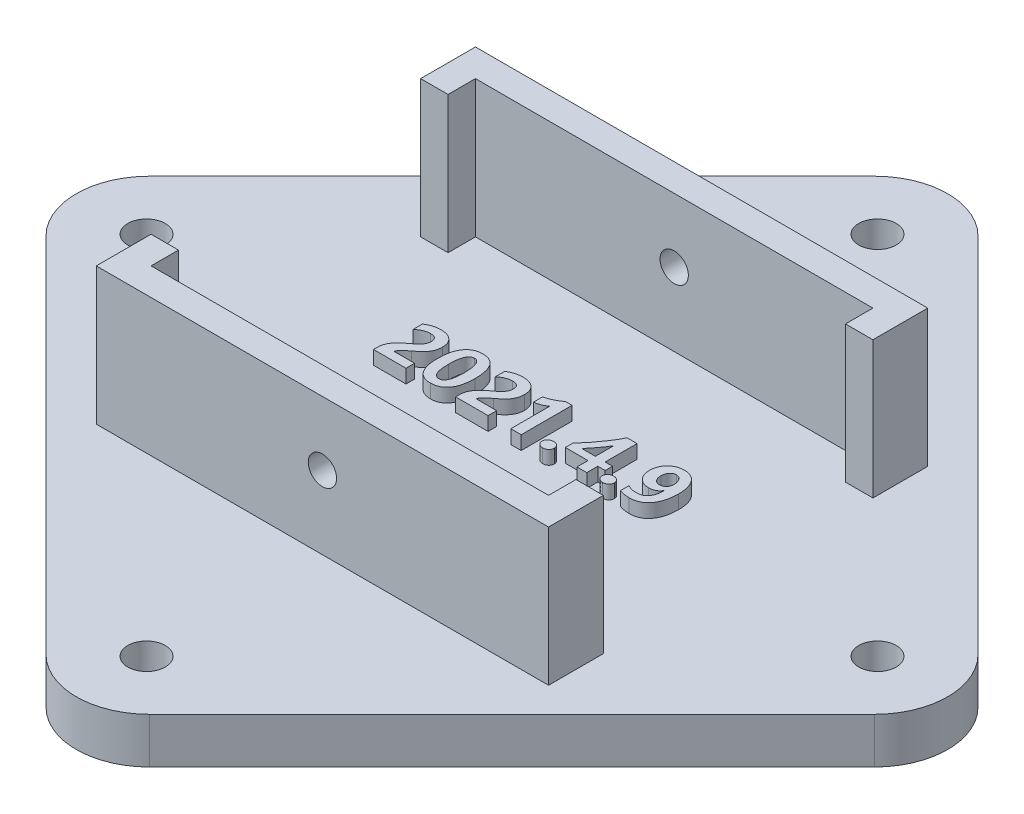
from build123d import *

# Parameters (mm, degrees)
SKETCH_1_R               = 2.05
EXTRUDE_1_DEPTH          = 5
EXTRUDE_2_DEPTH          = 15
CUT_EXTRUDE_1_DEPTH      = 86.775919648
CUT_EXTRUDE_1_DEPTH_BACK = 86.775919648
SKETCH_3_R               = 1.55
EXTRUDE_3_DEPTH          = 1.5


with BuildPart() as part:
    # 草图1 → 凸台-拉伸1 (new body)
    with BuildSketch(Plane(origin=(0, 0, 0), x_dir=(1, 0, 0), z_dir=(0, 1, 0))):
        with BuildLine():
            Line((-5.656854249, 45.343145751), (-45.343145751, 5.656854249))
            ThreePointArc((-45.343145751, 5.656854249), (-47.686291501, 0), (-45.343145751, -5.656854249))
            Line((-45.343145751, -5.656854249), (-5.656854249, -45.343145751))
            ThreePointArc((-5.656854249, -45.343145751), (0, -47.686291501), (5.656854249, -45.343145751))
            Line((5.656854249, -45.343145751), (45.343145751, -5.656854249))
            ThreePointArc((45.343145751, -5.656854249), (47.686291501, 0), (45.343145751, 5.656854249))
            Line((45.343145751, 5.656854249), (5.656854249, 45.343145751))
            ThreePointArc((5.656854249, 45.343145751), (0, 47.686291501), (-5.656854249, 45.343145751))
        make_face()
        with Locations((0, 40)):
            Circle(SKETCH_1_R, mode=Mode.SUBTRACT)
        with Locations((40, 0)):
            Circle(SKETCH_1_R, mode=Mode.SUBTRACT)
        with Locations((0, -40)):
            Circle(SKETCH_1_R, mode=Mode.SUBTRACT)
        with Locations((-40, 0)):
            Circle(SKETCH_1_R, mode=Mode.SUBTRACT)
    extrude(amount=EXTRUDE_1_DEPTH)

    # 草图2 → 凸台-拉伸2 (add)
    with BuildSketch(Plane(origin=(0, 5, 0), x_dir=(1, 0, 0), z_dir=(0, 1, 0))):
        Polygon((-24.75, 14.75), (-21.75, 14.75), (-21.75, 17.75), (21.75, 17.75), (21.75, 14.75), (24.75, 14.75), (24.75, 20.75), (-24.75, 20.75), align=None)
        Polygon((24.75, -20.75), (-24.75, -20.75), (-24.75, -14.75), (-21.75, -14.75), (-21.75, -17.75), (21.75, -17.75), (21.75, -14.75), (24.75, -14.75), align=None)
    extrude(amount=EXTRUDE_2_DEPTH)

    # 草图3 → 切除-拉伸1 (cut, two sides: drawn at the far end of the back side and taken through both)
    with BuildSketch(Plane.XY.offset(20.75).offset(-CUT_EXTRUDE_1_DEPTH_BACK)):
        with Locations((0, 13)):
            Circle(SKETCH_3_R)
    extrude(amount=CUT_EXTRUDE_1_DEPTH + CUT_EXTRUDE_1_DEPTH_BACK, mode=Mode.SUBTRACT)

    # 草图4 → 凸台-拉伸3 (add)
    # profile 1 of 8: a face of its own
    with BuildSketch(Plane(origin=(0, 5, 0), x_dir=(1, 0, 0), z_dir=(0, 1, 0))):
        with BuildLine():
            Line((-13.839081555, 0.93902439), (-11.603658537, 0.93902439))
            Line((-11.603658537, 0.93902439), (-11.603658537, 0))
            Line((-11.603658537, 0), (-15.158536585, 0))
            Line((-15.158536585, 0), (-15.158536585, 0.406631098))
            add(Edge.make_bspline(
                [(-15.158536585, 0.406631098), (-15.157023368, 0.476628449), (-15.154057415, 0.613825394), (-15.12187145, 0.814536245), (-15.073501918, 1.006317727), (-15.003237267, 1.188936995), (-14.915030438, 1.362720107), (-14.814619594, 1.53168365), (-14.697135067, 1.693137954), (-14.587786261, 1.823917133), (-14.489760349, 1.92785591), (-14.404994889, 2.008414433), (-14.312042227, 2.093373657), (-14.209089969, 2.181204758), (-14.096832549, 2.272748869), (-13.974222166, 2.366230706), (-13.843081887, 2.464502216), (-13.751223863, 2.529110506), (-13.703887195, 2.562404726)],
                knots=[0, 0, 0, 0, 1.235463945, 2.421547066, 3.581528553, 4.724177644, 5.869489868, 7.020953534, 8.192434176, 9.392640776, 10.02996671, 10.715178343, 11.457812761, 12.254335723, 13.105362497, 14.016280847, 14.97774141, 16, 16, 16, 16], degree=3))
            add(Edge.make_bspline(
                [(-13.703887195, 2.562404726), (-13.661048261, 2.59426157), (-13.577708432, 2.656236594), (-13.460157705, 2.751008993), (-13.349867961, 2.840336928), (-13.25240984, 2.929694439), (-13.163277438, 3.014288777), (-13.085885243, 3.097413623), (-13.01749831, 3.176979916), (-12.939775173, 3.277268952), (-12.861769848, 3.405125416), (-12.793692928, 3.5644759), (-12.751901903, 3.729521825), (-12.746574126, 3.841451403), (-12.743902439, 3.89758003)],
                knots=[0, 0, 0, 0, 1.124221039, 2.187085011, 3.179985414, 4.1124088, 4.970962739, 5.767369762, 6.503150781, 7.18007546, 8.438112042, 9.644755015, 10.818929971, 12, 12, 12, 12], degree=3))
            add(Edge.make_bspline(
                [(-12.743902439, 3.89758003), (-12.744467369, 3.926952188), (-12.745566697, 3.984109128), (-12.755194885, 4.067191928), (-12.770529267, 4.144814647), (-12.792737221, 4.216777249), (-12.82074936, 4.283077732), (-12.855601244, 4.343023994), (-12.896163185, 4.397730856), (-12.943157632, 4.446877864), (-12.997064929, 4.490218401), (-13.057593091, 4.526864215), (-13.123515583, 4.558360828), (-13.195981146, 4.583609255), (-13.274597175, 4.603176867), (-13.359324296, 4.617914242), (-13.45045504, 4.626125937), (-13.513131799, 4.627392126), (-13.545636433, 4.62804878)],
                knots=[0, 0, 0, 0, 1.133448933, 2.205642312, 3.223814888, 4.18351512, 5.107792621, 5.995951473, 6.85359169, 7.731039516, 8.613447048, 9.515420728, 10.456369029, 11.428774843, 12.472086912, 13.580554081, 14.745257334, 16, 16, 16, 16], degree=3))
            add(Edge.make_bspline(
                [(-13.545636433, 4.62804878), (-13.60409107, 4.626630671), (-13.720945949, 4.623795771), (-13.894579238, 4.594717536), (-14.066623987, 4.550836702), (-14.23659706, 4.488813617), (-14.404291155, 4.408107134), (-14.569543945, 4.310388149), (-14.733665077, 4.195608753), (-14.837153466, 4.10738067), (-14.890243902, 4.062118902)],
                knots=[0, 0, 0, 0, 0.939522063, 1.878169839, 2.824056393, 3.792900055, 4.78321315, 5.81347213, 6.878292338, 8, 8, 8, 8], degree=3))
            Line((-14.890243902, 4.062118902), (-14.890243902, 5.092320884))
            add(Edge.make_bspline(
                [(-14.890243902, 5.092320884), (-14.831763716, 5.130282083), (-14.715585181, 5.205696968), (-14.532303182, 5.301809196), (-14.34427215, 5.383882486), (-14.15104678, 5.451538996), (-13.952025514, 5.502279245), (-13.748079607, 5.54071874), (-13.538442013, 5.562807945), (-13.396867507, 5.565644381), (-13.325552591, 5.567073171)],
                knots=[0, 0, 0, 0, 1.007429259, 2.001389931, 2.987429445, 3.971229237, 4.957229955, 5.953650675, 6.969198396, 8, 8, 8, 8], degree=3))
            add(Edge.make_bspline(
                [(-13.325552591, 5.567073171), (-13.26086528, 5.56603841), (-13.134660022, 5.564019586), (-12.950777692, 5.543309131), (-12.777012385, 5.511666622), (-12.614048939, 5.465148105), (-12.460921644, 5.406886553), (-12.318860177, 5.333616777), (-12.185798195, 5.249327786), (-12.065798016, 5.149827155), (-11.955893322, 5.041822715), (-11.862130261, 4.920727447), (-11.78236078, 4.790185345), (-11.715644622, 4.650370077), (-11.665289652, 4.499999938), (-11.630396943, 4.340073466), (-11.607479353, 4.17037339), (-11.604954299, 4.053812411), (-11.603658537, 3.993997713)],
                knots=[0, 0, 0, 0, 1.175700782, 2.29379795, 3.360181687, 4.383610167, 5.370921772, 6.333926658, 7.28536179, 8.228791148, 9.16300247, 10.081644873, 11.005433281, 11.94020586, 12.892298038, 13.881630337, 14.912932592, 16, 16, 16, 16], degree=3))
            add(Edge.make_bspline(
                [(-11.603658537, 3.993997713), (-11.605148078, 3.927181802), (-11.608060283, 3.796549951), (-11.634375986, 3.605829657), (-11.674217377, 3.424270035), (-11.733812006, 3.252534917), (-11.809192488, 3.088830471), (-11.898978977, 2.930975891), (-12.00282337, 2.777381915), (-12.10292981, 2.654123351), (-12.19298968, 2.555485682), (-12.271152788, 2.478078742), (-12.357846699, 2.396289504), (-12.454812565, 2.311594374), (-12.560366755, 2.222457907), (-12.676230761, 2.1301057), (-12.801435622, 2.034179187), (-12.888773087, 1.969784485), (-12.93359375, 1.936737805)],
                knots=[0, 0, 0, 0, 1.251525673, 2.446859026, 3.60148383, 4.729825321, 5.845964658, 6.974685934, 8.129533438, 9.31659125, 9.946781861, 10.631911092, 11.377579922, 12.18005771, 13.044278351, 13.966510779, 14.956434852, 16, 16, 16, 16], degree=3))
            add(Edge.make_bspline(
                [(-12.93359375, 1.936737805), (-12.97664653, 1.904360187), (-13.05929537, 1.842204561), (-13.17714431, 1.750800374), (-13.28362642, 1.665106127), (-13.379957634, 1.585421312), (-13.463883437, 1.51025186), (-13.538070028, 1.441906836), (-13.60125127, 1.379509556), (-13.667501772, 1.304900442), (-13.733493599, 1.219293515), (-13.793193269, 1.120958042), (-13.830916041, 1.028302268), (-13.836500676, 0.967242503), (-13.839081555, 0.93902439)],
                knots=[0, 0, 0, 0, 1.404320321, 2.695887337, 3.887765454, 4.967519503, 5.954491951, 6.824443279, 7.597203516, 8.268042687, 9.424676016, 10.408660756, 11.264579691, 12, 12, 12, 12], degree=3))
        make_face()
    # profile 2 of 8: a face of its own
    with BuildSketch(Plane(origin=(0, 5, 0), x_dir=(1, 0, 0), z_dir=(0, 1, 0))):
        with BuildLine():
            add(Edge.make_bspline(
                [(-10.798780488, 2.661966463), (-10.797123271, 2.77623746), (-10.79390125, 2.998407248), (-10.770434055, 3.32119823), (-10.728299198, 3.623171578), (-10.671373242, 3.90414239), (-10.598568922, 4.164999147), (-10.50752152, 4.404171345), (-10.400364864, 4.623130487), (-10.276849069, 4.820937364), (-10.137122612, 4.996956556), (-9.982508103, 5.150449466), (-9.812081288, 5.279437964), (-9.627151975, 5.385100149), (-9.427362613, 5.467176987), (-9.213111436, 5.525869012), (-8.984065832, 5.560843322), (-8.826534484, 5.564960727), (-8.745712652, 5.567073171)],
                knots=[0, 0, 0, 0, 1.362149222, 2.648339604, 3.855059559, 4.994364565, 6.063467114, 7.079713061, 8.040703448, 8.965038602, 9.854085429, 10.71394008, 11.555148663, 12.394499815, 13.245953674, 14.122892571, 15.036945591, 16, 16, 16, 16], degree=3))
            add(Edge.make_bspline(
                [(-8.745712652, 5.567073171), (-8.668738489, 5.565252945), (-8.518952158, 5.561710914), (-8.301961683, 5.528746034), (-8.099579057, 5.474289433), (-7.912167358, 5.397668402), (-7.739196584, 5.299452072), (-7.582142969, 5.178678569), (-7.438989695, 5.036847916), (-7.312296285, 4.872199548), (-7.200642417, 4.685945319), (-7.105077283, 4.478148132), (-7.021370899, 4.250054007), (-6.956949471, 3.999042378), (-6.904453305, 3.727146475), (-6.867324504, 3.43346455), (-6.845379523, 3.118193697), (-6.842796947, 2.900951341), (-6.841463415, 2.788776677)],
                knots=[0, 0, 0, 0, 0.965457368, 1.878712426, 2.746517445, 3.589928668, 4.412634501, 5.235095014, 6.068973012, 6.934471745, 7.835171815, 8.788338411, 9.800728824, 10.880036143, 12.036434764, 13.274035315, 14.59242838, 16, 16, 16, 16], degree=3))
            add(Edge.make_bspline(
                [(-6.841463415, 2.788776677), (-6.843040629, 2.67798806), (-6.84610446, 2.46277466), (-6.87067908, 2.149631101), (-6.909471477, 1.855776886), (-6.965856837, 1.58107219), (-7.03894017, 1.325916559), (-7.12780179, 1.090077598), (-7.232748491, 0.873542716), (-7.35397251, 0.677328877), (-7.490714332, 0.501937811), (-7.641899461, 0.349055995), (-7.807932656, 0.219042936), (-7.990074884, 0.115440459), (-8.185181515, 0.032913764), (-8.394910666, -0.026010373), (-8.619132836, -0.060774408), (-8.773535083, -0.064939873), (-8.852610518, -0.067073171)],
                knots=[0, 0, 0, 0, 1.347026978, 2.616679083, 3.817007038, 4.94920165, 6.023427643, 7.04117154, 8.010084628, 8.944873626, 9.840535256, 10.708624195, 11.553238949, 12.396271226, 13.24913524, 14.123221321, 15.038828169, 16, 16, 16, 16], degree=3))
            add(Edge.make_bspline(
                [(-8.852610518, -0.067073171), (-8.931338034, -0.065300475), (-9.084267605, -0.061856983), (-9.305902344, -0.028323913), (-9.512499116, 0.024394728), (-9.704015333, 0.099345004), (-9.880814399, 0.19524006), (-10.042140358, 0.313110126), (-10.187130379, 0.453840538), (-10.317489353, 0.614860989), (-10.432004063, 0.797684247), (-10.530471272, 1.001784336), (-10.614149342, 1.226710046), (-10.681450349, 1.473099742), (-10.735042401, 1.740236358), (-10.771483016, 2.028848128), (-10.795244566, 2.338427843), (-10.797577334, 2.551877254), (-10.798780488, 2.661966463)],
                knots=[0, 0, 0, 0, 0.99019984, 1.923480437, 2.813898109, 3.668707358, 4.504860987, 5.338502612, 6.174922047, 7.040774161, 7.939758049, 8.88358336, 9.888038246, 10.95578409, 12.094795546, 13.314162118, 14.614745452, 16, 16, 16, 16], degree=3))
        make_face()
        with BuildLine():
            add(Edge.make_bspline(
                [(-9.658536585, 2.690262957), (-9.658107759, 2.614090281), (-9.657277203, 2.46655792), (-9.645976804, 2.25305655), (-9.631146007, 2.054035709), (-9.608464771, 1.869636369), (-9.577883824, 1.700139331), (-9.542763744, 1.544851221), (-9.500657949, 1.404320344), (-9.449478428, 1.279081326), (-9.395242981, 1.167002101), (-9.331780389, 1.070803596), (-9.262071846, 0.988721987), (-9.185603496, 0.920842831), (-9.101469339, 0.868664904), (-9.011193222, 0.83163962), (-8.914176415, 0.808759233), (-8.84714906, 0.806193457), (-8.812785823, 0.804878049)],
                knots=[0, 0, 0, 0, 1.603335939, 3.105364685, 4.499651755, 5.804038191, 7.014333458, 8.12391888, 9.154458006, 10.098101136, 10.969642064, 11.771234135, 12.517045613, 13.230995278, 13.914645637, 14.590658982, 15.277466367, 16, 16, 16, 16], degree=3))
            add(Edge.make_bspline(
                [(-8.812785823, 0.804878049), (-8.779105705, 0.806130768), (-8.713006876, 0.808589289), (-8.617704518, 0.832606132), (-8.52871142, 0.870961416), (-8.446599913, 0.924991558), (-8.371153488, 0.994527214), (-8.303151587, 1.079391273), (-8.241395195, 1.178787438), (-8.18560946, 1.292763111), (-8.137924369, 1.422584396), (-8.096868743, 1.567499145), (-8.059399235, 1.726703624), (-8.032520483, 1.901702607), (-8.009157151, 2.09143136), (-7.992618791, 2.296657361), (-7.983436404, 2.516903915), (-7.982295787, 2.668595089), (-7.981707317, 2.746855945)],
                knots=[0, 0, 0, 0, 0.695122503, 1.364210887, 2.01756402, 2.690577167, 3.385737182, 4.130131596, 4.931608675, 5.800404884, 6.748758349, 7.786371724, 8.912792794, 10.127346512, 11.444091896, 12.864250838, 14.382197134, 16, 16, 16, 16], degree=3))
            add(Edge.make_bspline(
                [(-7.981707317, 2.746855945), (-7.98227147, 2.825467531), (-7.983365108, 2.977859789), (-7.992864864, 3.198758572), (-8.008190239, 3.404337275), (-8.030162039, 3.594536135), (-8.057672517, 3.769994345), (-8.093572077, 3.930047785), (-8.133659578, 4.075324795), (-8.180887791, 4.205037214), (-8.233917247, 4.320282259), (-8.294198719, 4.420021671), (-8.361324595, 4.504347789), (-8.433544533, 4.57500142), (-8.514022735, 4.628928434), (-8.600862435, 4.667401721), (-8.693777813, 4.691320962), (-8.758146276, 4.693843279), (-8.790777439, 4.695121951)],
                knots=[0, 0, 0, 0, 1.630882594, 3.161542638, 4.586250292, 5.906888024, 7.132974829, 8.268926783, 9.308286633, 10.257544667, 11.129744202, 11.936458409, 12.668801266, 13.360835464, 14.024190203, 14.666626331, 15.324055123, 16, 16, 16, 16], degree=3))
            add(Edge.make_bspline(
                [(-8.790777439, 4.695121951), (-8.825874209, 4.693970886), (-8.894852245, 4.69170862), (-8.994137856, 4.666165129), (-9.08751247, 4.627455862), (-9.172680088, 4.570399008), (-9.252253887, 4.49963048), (-9.32375822, 4.412365938), (-9.387567903, 4.309455078), (-9.444979679, 4.191307114), (-9.496220804, 4.057761086), (-9.539878458, 3.908377782), (-9.575995391, 3.743327875), (-9.606072554, 3.56281536), (-9.630255146, 3.366685381), (-9.646172197, 3.155093425), (-9.657233752, 2.927931495), (-9.658092229, 2.771324445), (-9.658536585, 2.690262957)],
                knots=[0, 0, 0, 0, 0.699301861, 1.374384831, 2.033897946, 2.709161106, 3.410720971, 4.153847772, 4.953195278, 5.823624816, 6.773225395, 7.806231225, 8.928340231, 10.14513842, 11.459470789, 12.873025863, 14.381444661, 16, 16, 16, 16], degree=3))
        make_face(mode=Mode.SUBTRACT)
    # profile 3 of 8: a face of its own
    with BuildSketch(Plane(origin=(0, 5, 0), x_dir=(1, 0, 0), z_dir=(0, 1, 0))):
        with BuildLine():
            Line((-4.851276677, 0.93902439), (-2.615853659, 0.93902439))
            Line((-2.615853659, 0.93902439), (-2.615853659, 0))
            Line((-2.615853659, 0), (-6.170731707, 0))
            Line((-6.170731707, 0), (-6.170731707, 0.406631098))
            add(Edge.make_bspline(
                [(-6.170731707, 0.406631098), (-6.16921849, 0.476628449), (-6.166252536, 0.613825394), (-6.134066572, 0.814536245), (-6.08569704, 1.006317727), (-6.015432389, 1.188936995), (-5.92722556, 1.362720107), (-5.826814716, 1.53168365), (-5.709330189, 1.693137954), (-5.599981383, 1.823917133), (-5.501955471, 1.92785591), (-5.417190011, 2.008414433), (-5.324237349, 2.093373657), (-5.221285091, 2.181204758), (-5.10902767, 2.272748869), (-4.986417288, 2.366230706), (-4.855277009, 2.464502216), (-4.763418985, 2.529110506), (-4.716082317, 2.562404726)],
                knots=[0, 0, 0, 0, 1.235463945, 2.421547066, 3.581528553, 4.724177644, 5.869489868, 7.020953534, 8.192434176, 9.392640776, 10.02996671, 10.715178343, 11.457812761, 12.254335723, 13.105362497, 14.016280847, 14.97774141, 16, 16, 16, 16], degree=3))
            add(Edge.make_bspline(
                [(-4.716082317, 2.562404726), (-4.673243383, 2.59426157), (-4.589903554, 2.656236594), (-4.472352826, 2.751008993), (-4.362063083, 2.840336928), (-4.264604962, 2.929694439), (-4.17547256, 3.014288777), (-4.098080365, 3.097413623), (-4.029693432, 3.176979916), (-3.951970295, 3.277268952), (-3.87396497, 3.405125416), (-3.80588805, 3.5644759), (-3.764097025, 3.729521825), (-3.758769248, 3.841451403), (-3.756097561, 3.89758003)],
                knots=[0, 0, 0, 0, 1.124221039, 2.187085011, 3.179985414, 4.1124088, 4.970962739, 5.767369762, 6.503150781, 7.18007546, 8.438112042, 9.644755015, 10.818929971, 12, 12, 12, 12], degree=3))
            add(Edge.make_bspline(
                [(-3.756097561, 3.89758003), (-3.756662491, 3.926952188), (-3.757761819, 3.984109128), (-3.767390007, 4.067191928), (-3.782724389, 4.144814647), (-3.804932343, 4.216777249), (-3.832944482, 4.283077732), (-3.867796366, 4.343023994), (-3.908358307, 4.397730856), (-3.955352754, 4.446877864), (-4.009260051, 4.490218401), (-4.069788213, 4.526864215), (-4.135710704, 4.558360828), (-4.208176268, 4.583609255), (-4.286792297, 4.603176867), (-4.371519418, 4.617914242), (-4.462650162, 4.626125937), (-4.525326921, 4.627392126), (-4.557831555, 4.62804878)],
                knots=[0, 0, 0, 0, 1.133448933, 2.205642312, 3.223814888, 4.18351512, 5.107792621, 5.995951473, 6.85359169, 7.731039516, 8.613447048, 9.515420728, 10.456369029, 11.428774843, 12.472086912, 13.580554081, 14.745257334, 16, 16, 16, 16], degree=3))
            add(Edge.make_bspline(
                [(-4.557831555, 4.62804878), (-4.616286192, 4.626630671), (-4.733141071, 4.623795771), (-4.906774359, 4.594717536), (-5.078819109, 4.550836702), (-5.248792182, 4.488813617), (-5.416486277, 4.408107134), (-5.581739067, 4.310388149), (-5.745860198, 4.195608753), (-5.849348588, 4.10738067), (-5.902439024, 4.062118902)],
                knots=[0, 0, 0, 0, 0.939522063, 1.878169839, 2.824056393, 3.792900055, 4.78321315, 5.81347213, 6.878292338, 8, 8, 8, 8], degree=3))
            Line((-5.902439024, 4.062118902), (-5.902439024, 5.092320884))
            add(Edge.make_bspline(
                [(-5.902439024, 5.092320884), (-5.843958838, 5.130282083), (-5.727780303, 5.205696968), (-5.544498304, 5.301809196), (-5.356467272, 5.383882486), (-5.163241902, 5.451538996), (-4.964220636, 5.502279245), (-4.760274729, 5.54071874), (-4.550637135, 5.562807945), (-4.409062629, 5.565644381), (-4.337747713, 5.567073171)],
                knots=[0, 0, 0, 0, 1.007429259, 2.001389931, 2.987429445, 3.971229237, 4.957229955, 5.953650675, 6.969198396, 8, 8, 8, 8], degree=3))
            add(Edge.make_bspline(
                [(-4.337747713, 5.567073171), (-4.273060402, 5.56603841), (-4.146855143, 5.564019586), (-3.962972814, 5.543309131), (-3.789207507, 5.511666622), (-3.626244061, 5.465148105), (-3.473116766, 5.406886553), (-3.331055299, 5.333616777), (-3.197993317, 5.249327786), (-3.077993138, 5.149827155), (-2.968088444, 5.041822715), (-2.874325383, 4.920727447), (-2.794555902, 4.790185345), (-2.727839744, 4.650370077), (-2.677484774, 4.499999938), (-2.642592065, 4.340073466), (-2.619674475, 4.17037339), (-2.617149421, 4.053812411), (-2.615853659, 3.993997713)],
                knots=[0, 0, 0, 0, 1.175700782, 2.29379795, 3.360181687, 4.383610167, 5.370921772, 6.333926658, 7.28536179, 8.228791148, 9.16300247, 10.081644873, 11.005433281, 11.94020586, 12.892298038, 13.881630337, 14.912932592, 16, 16, 16, 16], degree=3))
            add(Edge.make_bspline(
                [(-2.615853659, 3.993997713), (-2.6173432, 3.927181802), (-2.620255405, 3.796549951), (-2.646571108, 3.605829657), (-2.686412499, 3.424270035), (-2.746007128, 3.252534917), (-2.82138761, 3.088830471), (-2.911174099, 2.930975891), (-3.015018492, 2.777381915), (-3.115124932, 2.654123351), (-3.205184802, 2.555485682), (-3.28334791, 2.478078742), (-3.370041821, 2.396289504), (-3.467007687, 2.311594374), (-3.572561877, 2.222457907), (-3.688425883, 2.1301057), (-3.813630744, 2.034179187), (-3.900968209, 1.969784485), (-3.945788872, 1.936737805)],
                knots=[0, 0, 0, 0, 1.251525673, 2.446859026, 3.60148383, 4.729825321, 5.845964658, 6.974685934, 8.129533438, 9.31659125, 9.946781861, 10.631911092, 11.377579922, 12.18005771, 13.044278351, 13.966510779, 14.956434852, 16, 16, 16, 16], degree=3))
            add(Edge.make_bspline(
                [(-3.945788872, 1.936737805), (-3.988841652, 1.904360187), (-4.071490492, 1.842204561), (-4.189339432, 1.750800374), (-4.295821542, 1.665106127), (-4.392152756, 1.585421312), (-4.476078559, 1.51025186), (-4.55026515, 1.441906836), (-4.613446392, 1.379509556), (-4.679696894, 1.304900442), (-4.745688721, 1.219293515), (-4.805388391, 1.120958042), (-4.843111163, 1.028302268), (-4.848695798, 0.967242503), (-4.851276677, 0.93902439)],
                knots=[0, 0, 0, 0, 1.404320321, 2.695887337, 3.887765454, 4.967519503, 5.954491951, 6.824443279, 7.597203516, 8.268042687, 9.424676016, 10.408660756, 11.264579691, 12, 12, 12, 12], degree=3))
        make_face()
    # profile 4 of 8: a face of its own
    with BuildSketch(Plane(origin=(0, 5, 0), x_dir=(1, 0, 0), z_dir=(0, 1, 0))):
        with BuildLine():
            Line((1.006097561, 5.567073171), (1.006097561, 0))
            Line((1.006097561, 0), (-0.134146341, 0))
            Line((-0.134146341, 0), (-0.134146341, 4.268578506))
            add(Edge.make_bspline(
                [(-0.134146341, 4.268578506), (-0.172698655, 4.238074819), (-0.253482199, 4.174156579), (-0.39237924, 4.090431007), (-0.549777095, 4.009517614), (-0.723022666, 3.936837654), (-0.901357704, 3.871881111), (-1.076631109, 3.819308686), (-1.244517083, 3.77928901), (-1.35494214, 3.763675519), (-1.408536585, 3.756097561)],
                knots=[0, 0, 0, 0, 0.848662771, 1.778310582, 2.796019528, 3.904804973, 5.021774656, 6.073981215, 7.065213005, 8, 8, 8, 8], degree=3))
            Line((-1.408536585, 3.756097561), (-1.408536585, 4.735994665))
            add(Edge.make_bspline(
                [(-1.408536585, 4.735994665), (-1.327942126, 4.760398996), (-1.168435831, 4.808698152), (-0.935975851, 4.893437668), (-0.710860976, 4.983877368), (-0.495202727, 5.084980456), (-0.28730884, 5.193256006), (-0.086630613, 5.30773165), (0.10437363, 5.433060163), (0.226399232, 5.522526819), (0.287157012, 5.567073171)],
                knots=[0, 0, 0, 0, 1.064073614, 2.105931847, 3.125864915, 4.129294696, 5.114699703, 6.087842653, 7.047917545, 8, 8, 8, 8], degree=3))
            Line((0.287157012, 5.567073171), (1.006097561, 5.567073171))
        make_face()
    # profile 5 of 8: a face of its own
    with BuildSketch(Plane(origin=(0, 5, 0), x_dir=(1, 0, 0), z_dir=(0, 1, 0))):
        with BuildLine():
            add(Edge.make_bspline(
                [(2.75, 0.538681402), (2.75222309, 0.58092654), (2.756562217, 0.663382511), (2.796449565, 0.780399251), (2.859317876, 0.885799192), (2.947329025, 0.975165762), (3.051647581, 1.047579956), (3.167467319, 1.102512932), (3.293977611, 1.134424951), (3.381429476, 1.138280258), (3.425971799, 1.140243902)],
                knots=[0, 0, 0, 0, 1.003083505, 1.957863759, 2.909305103, 3.903417016, 4.918702764, 5.91964595, 6.940402229, 8, 8, 8, 8], degree=3))
            add(Edge.make_bspline(
                [(3.425971799, 1.140243902), (3.470900665, 1.138440505), (3.5585237, 1.13492341), (3.684491908, 1.101207438), (3.799422748, 1.046155924), (3.900374851, 0.970383692), (3.986019667, 0.880801648), (4.0470266, 0.775899282), (4.085761924, 0.660828418), (4.089541183, 0.579862707), (4.091463415, 0.538681402)],
                knots=[0, 0, 0, 0, 1.077227083, 2.100874465, 3.106587595, 4.120144769, 5.117493505, 6.061464187, 7.014009343, 8, 8, 8, 8], degree=3))
            add(Edge.make_bspline(
                [(4.091463415, 0.538681402), (4.089633913, 0.495396463), (4.086080148, 0.411316478), (4.047192124, 0.292478926), (3.986913828, 0.185459826), (3.900361649, 0.096258716), (3.798202873, 0.022205641), (3.680053386, -0.029065886), (3.550347002, -0.061734714), (3.459366587, -0.065254257), (3.412347561, -0.067073171)],
                knots=[0, 0, 0, 0, 1.015222207, 1.972045464, 2.911187852, 3.88241816, 4.872497692, 5.862474826, 6.895318807, 8, 8, 8, 8], degree=3))
            add(Edge.make_bspline(
                [(3.412347561, -0.067073171), (3.36810324, -0.065300793), (3.281828767, -0.061844734), (3.157906581, -0.027653586), (3.043615671, 0.026388303), (2.941760425, 0.101371619), (2.856802943, 0.192834507), (2.793828963, 0.297807135), (2.75729847, 0.415114447), (2.752470163, 0.496860243), (2.75, 0.538681402)],
                knots=[0, 0, 0, 0, 1.060071275, 2.067092188, 3.061213085, 4.081108787, 5.084210499, 6.03928564, 6.996898288, 8, 8, 8, 8], degree=3))
        make_face()
    # profile 6 of 8: a face of its own
    with BuildSketch(Plane(origin=(0, 5, 0), x_dir=(1, 0, 0), z_dir=(0, 1, 0))):
        with BuildLine():
            Line((8.182926829, 5.5), (8.182926829, 2.012195122))
            Line((8.182926829, 2.012195122), (8.987804878, 2.012195122))
            Line((8.987804878, 2.012195122), (8.987804878, 1.207317073))
            Line((8.987804878, 1.207317073), (8.182926829, 1.207317073))
            Line((8.182926829, 1.207317073), (8.182926829, 0))
            Line((8.182926829, 0), (7.109756098, 0))
            Line((7.109756098, 0), (7.109756098, 1.207317073))
            Line((7.109756098, 1.207317073), (4.62804878, 1.207317073))
            Line((4.62804878, 1.207317073), (4.62804878, 2.01953125))
            add(Edge.make_bspline(
                [(4.62804878, 2.01953125), (4.755413227, 2.162679222), (5.010604729, 2.449495106), (5.377525858, 2.894362128), (5.733577883, 3.350309661), (6.017225049, 3.739130565), (6.23541501, 4.050159071), (6.388245558, 4.277410859), (6.530978407, 4.497978581), (6.664320434, 4.710913319), (6.785617184, 4.91801737), (6.898329906, 5.117026517), (7.00044277, 5.30975534), (7.061939401, 5.437621865), (7.091939787, 5.5)],
                knots=[0, 0, 0, 0, 1.612591278, 3.231039777, 4.852607564, 6.481070372, 7.281274094, 8.050294701, 8.785938104, 9.492501681, 10.164703264, 10.805860795, 11.417453656, 12, 12, 12, 12], degree=3))
            Line((7.091939787, 5.5), (8.182926829, 5.5))
        make_face()
        with BuildLine():
            Line((5.640434451, 2.012195122), (7.109756098, 2.012195122))
            Line((7.109756098, 2.012195122), (7.109756098, 4.023342226))
            add(Edge.make_bspline(
                [(7.109756098, 4.023342226), (7.078071485, 3.967176916), (7.010756672, 3.847852202), (6.893996229, 3.664051759), (6.76179658, 3.461342418), (6.635491378, 3.283290316), (6.52352266, 3.12829256), (6.426793066, 2.999866338), (6.321404603, 2.860200417), (6.204274715, 2.711290152), (6.077745084, 2.551348971), (5.941858801, 2.380297621), (5.79439853, 2.199930445), (5.692852019, 2.076110218), (5.640434451, 2.012195122)],
                knots=[0, 0, 0, 0, 0.930700916, 1.977299165, 3.142346225, 4.423824771, 5.127871785, 5.902429712, 6.744574135, 7.653448292, 8.637096149, 9.68845783, 10.806798818, 12, 12, 12, 12], degree=3))
        make_face(mode=Mode.SUBTRACT)
    # profile 7 of 8: a face of its own
    with BuildSketch(Plane(origin=(0, 5, 0), x_dir=(1, 0, 0), z_dir=(0, 1, 0))):
        with BuildLine():
            add(Edge.make_bspline(
                [(9.323170732, 0.538681402), (9.325393822, 0.58092654), (9.329732949, 0.663382511), (9.369620296, 0.780399251), (9.432488608, 0.885799192), (9.520499757, 0.975165762), (9.624818313, 1.047579956), (9.740638051, 1.102512932), (9.867148343, 1.134424951), (9.954600208, 1.138280258), (9.99914253, 1.140243902)],
                knots=[0, 0, 0, 0, 1.003083505, 1.957863759, 2.909305103, 3.903417016, 4.918702764, 5.91964595, 6.940402229, 8, 8, 8, 8], degree=3))
            add(Edge.make_bspline(
                [(9.99914253, 1.140243902), (10.044071396, 1.138440505), (10.131694432, 1.13492341), (10.257662639, 1.101207438), (10.37259348, 1.046155924), (10.473545583, 0.970383692), (10.559190399, 0.880801648), (10.620197332, 0.775899282), (10.658932656, 0.660828418), (10.662711915, 0.579862707), (10.664634146, 0.538681402)],
                knots=[0, 0, 0, 0, 1.077227083, 2.100874465, 3.106587595, 4.120144769, 5.117493505, 6.061464187, 7.014009343, 8, 8, 8, 8], degree=3))
            add(Edge.make_bspline(
                [(10.664634146, 0.538681402), (10.662804644, 0.495396463), (10.65925088, 0.411316478), (10.620362856, 0.292478926), (10.56008456, 0.185459826), (10.473532381, 0.096258716), (10.371373605, 0.022205641), (10.253224117, -0.029065886), (10.123517733, -0.061734714), (10.032537319, -0.065254257), (9.985518293, -0.067073171)],
                knots=[0, 0, 0, 0, 1.015222207, 1.972045464, 2.911187852, 3.88241816, 4.872497692, 5.862474826, 6.895318807, 8, 8, 8, 8], degree=3))
            add(Edge.make_bspline(
                [(9.985518293, -0.067073171), (9.941273972, -0.065300793), (9.854999499, -0.061844734), (9.731077313, -0.027653586), (9.616786403, 0.026388303), (9.514931157, 0.101371619), (9.429973675, 0.192834507), (9.366999695, 0.297807135), (9.330469202, 0.415114447), (9.325640894, 0.496860243), (9.323170732, 0.538681402)],
                knots=[0, 0, 0, 0, 1.060071275, 2.067092188, 3.061213085, 4.081108787, 5.084210499, 6.03928564, 6.996898288, 8, 8, 8, 8], degree=3))
        make_face()
    # profile 8 of 8: a face of its own
    with BuildSketch(Plane(origin=(0, 5, 0), x_dir=(1, 0, 0), z_dir=(0, 1, 0))):
        with BuildLine():
            add(Edge.make_bspline(
                [(11.737804878, 1.073170732), (11.774855147, 1.05158819), (11.849199846, 1.008280876), (11.966992587, 0.954449648), (12.089348796, 0.907616636), (12.216717944, 0.870557125), (12.348959642, 0.840666362), (12.485924646, 0.820198144), (12.628017927, 0.807163103), (12.724310275, 0.805648025), (12.773246951, 0.804878049)],
                knots=[0, 0, 0, 0, 0.949466968, 1.905190944, 2.865417177, 3.849916219, 4.841357726, 5.867011213, 6.915995049, 8, 8, 8, 8], degree=3))
            add(Edge.make_bspline(
                [(12.773246951, 0.804878049), (12.827108653, 0.805935767), (12.931732542, 0.807990338), (13.083456016, 0.828152336), (13.224597565, 0.861630368), (13.355951714, 0.907766448), (13.477271743, 0.967560019), (13.58838868, 1.041783317), (13.689312218, 1.12918326), (13.780353173, 1.229652794), (13.860014335, 1.343661806), (13.929369923, 1.470731606), (13.989207084, 1.61068282), (14.038048731, 1.764136569), (14.076591011, 1.93104448), (14.105493942, 2.110645342), (14.124693037, 2.303851508), (14.128474182, 2.436945573), (14.13043064, 2.505811738)],
                knots=[0, 0, 0, 0, 1.043542781, 2.027034069, 2.959876453, 3.850786358, 4.71986624, 5.574342274, 6.433633803, 7.301314561, 8.195511968, 9.122833358, 10.102611539, 11.141155732, 12.239934694, 13.419897346, 14.664990995, 16, 16, 16, 16], degree=3))
            Line((14.13043064, 2.505811738), (14.109470274, 2.513147866))
            add(Edge.make_bspline(
                [(14.109470274, 2.513147866), (14.078800625, 2.467933206), (14.018683045, 2.379305001), (13.910198233, 2.26217936), (13.787805614, 2.164557566), (13.652800467, 2.08385788), (13.505580999, 2.020631474), (13.344671808, 1.977151991), (13.171786578, 1.949030965), (13.051785913, 1.9464479), (12.990186738, 1.945121951)],
                knots=[0, 0, 0, 0, 0.995777088, 1.951887613, 2.899484225, 3.842784299, 4.813567454, 5.81250106, 6.877105135, 8, 8, 8, 8], degree=3))
            add(Edge.make_bspline(
                [(12.990186738, 1.945121951), (12.933495173, 1.946320912), (12.822415235, 1.948670123), (12.660179582, 1.973319818), (12.504658932, 2.008598741), (12.357830871, 2.063462013), (12.217176121, 2.129864794), (12.085693857, 2.21394433), (11.96140729, 2.311526823), (11.846873534, 2.423801434), (11.742113941, 2.546352349), (11.651992042, 2.679817481), (11.573480519, 2.819767868), (11.512376929, 2.969147866), (11.462005028, 3.124770745), (11.428324865, 3.288926034), (11.406601869, 3.460673002), (11.403845599, 3.577865843), (11.402439024, 3.637671494)],
                knots=[0, 0, 0, 0, 1.046034795, 2.049572613, 3.024376066, 3.985572894, 4.937721733, 5.891639049, 6.860855331, 7.850803132, 8.848601886, 9.832710231, 10.820195759, 11.806205193, 12.807937507, 13.836561242, 14.895957616, 16, 16, 16, 16], degree=3))
            add(Edge.make_bspline(
                [(11.402439024, 3.637671494), (11.403930131, 3.707627724), (11.406847903, 3.844516943), (11.433198492, 4.044623258), (11.472840338, 4.235258412), (11.532327342, 4.415061716), (11.606898961, 4.585220714), (11.698342895, 4.745261419), (11.807338036, 4.894915), (11.93144452, 5.033830562), (12.069347629, 5.158896272), (12.217594496, 5.2692076), (12.377460873, 5.360469986), (12.546550881, 5.436265945), (12.72602847, 5.495232777), (12.915620198, 5.536805766), (13.115243151, 5.562496409), (13.251763518, 5.565527794), (13.321360518, 5.567073171)],
                knots=[0, 0, 0, 0, 1.09675662, 2.146115622, 3.160648641, 4.146590745, 5.110747424, 6.070393823, 7.031603267, 8.009488368, 8.98697425, 9.946996012, 10.901890765, 11.868271388, 12.849007696, 13.859359379, 14.908718381, 16, 16, 16, 16], degree=3))
            add(Edge.make_bspline(
                [(13.321360518, 5.567073171), (13.393792632, 5.565165678), (13.535180251, 5.561442249), (13.74087614, 5.529343062), (13.934654719, 5.476794931), (14.116794295, 5.403368794), (14.287322884, 5.308540932), (14.444019686, 5.190648655), (14.589702158, 5.053369253), (14.722808182, 4.896015497), (14.84082702, 4.719007265), (14.945238909, 4.525676401), (15.031863854, 4.3146427), (15.102864099, 4.087690654), (15.158323118, 3.844127917), (15.197752629, 3.584254492), (15.220558595, 3.30760504), (15.223894915, 3.117897075), (15.225609756, 3.02038872)],
                knots=[0, 0, 0, 0, 0.968820094, 1.891138594, 2.777991308, 3.650434407, 4.512698194, 5.381287711, 6.267585799, 7.186390782, 8.132892618, 9.10966541, 10.121948763, 11.180570038, 12.288516618, 13.461407412, 14.695183994, 16, 16, 16, 16], degree=3))
            add(Edge.make_bspline(
                [(15.225609756, 3.02038872), (15.223874152, 2.904352429), (15.220496796, 2.678554543), (15.192138304, 2.349023611), (15.143847214, 2.03859354), (15.078751529, 1.745645071), (14.992670535, 1.472041168), (14.889027805, 1.216226569), (14.765191079, 0.979594797), (14.645395108, 0.79750016), (14.541684773, 0.661791185), (14.458917213, 0.568101995), (14.372708066, 0.479977244), (14.280974231, 0.400042162), (14.187078412, 0.323515778), (14.087462139, 0.255870516), (13.983822618, 0.195037858), (13.877109572, 0.13854756), (13.764609446, 0.09148921), (13.649384644, 0.047610623), (13.529555955, 0.012056793), (13.405090464, -0.015832417), (13.276806876, -0.038938924), (13.144279973, -0.055939964), (13.007790971, -0.065252787), (12.915441545, -0.066460706), (12.868616616, -0.067073171)],
                knots=[0, 0, 0, 0, 1.901975496, 3.701101141, 5.416562705, 7.048964338, 8.615674695, 10.113027798, 11.567991227, 12.986385286, 13.680526415, 14.366325712, 15.034491508, 15.699829051, 16.359871325, 17.019068378, 17.671212852, 18.329488873, 18.996475639, 19.668751759, 20.350016994, 21.04323621, 21.75880353, 22.486166897, 23.23242481, 24, 24, 24, 24], degree=3))
            add(Edge.make_bspline(
                [(12.868616616, -0.067073171), (12.815856376, -0.066446344), (12.711647496, -0.065208275), (12.557691772, -0.056086316), (12.408891384, -0.038623434), (12.264544794, -0.017481818), (12.125609721, 0.012564739), (11.990922867, 0.046449046), (11.861807654, 0.088358584), (11.778848388, 0.121795659), (11.737804878, 0.138338415)],
                knots=[0, 0, 0, 0, 1.094523514, 2.161837572, 3.197433472, 4.201878413, 5.186866933, 6.144824322, 7.082164956, 8, 8, 8, 8], degree=3))
            Line((11.737804878, 0.138338415), (11.737804878, 1.073170732))
        make_face()
        with BuildLine():
            add(Edge.make_bspline(
                [(12.542682927, 3.748761433), (12.543114372, 3.713438911), (12.54395794, 3.64437573), (12.555528068, 3.544074787), (12.569683756, 3.448952283), (12.595146197, 3.360832093), (12.623397253, 3.277394751), (12.660857138, 3.200544252), (12.703580928, 3.129038217), (12.75280626, 3.063715033), (12.808628016, 3.005900894), (12.869676489, 2.955655146), (12.934873493, 2.91180739), (13.005736709, 2.877674164), (13.080633512, 2.849685292), (13.161009111, 2.831385847), (13.24590229, 2.819567742), (13.304201651, 2.817915753), (13.333936738, 2.817073171)],
                knots=[0, 0, 0, 0, 1.22561017, 2.396333371, 3.503037693, 4.559410657, 5.576040021, 6.557997548, 7.521121161, 8.464801315, 9.391252834, 10.304428659, 11.206011476, 12.111908307, 13.029022852, 13.97635964, 14.967859644, 16, 16, 16, 16], degree=3))
            add(Edge.make_bspline(
                [(13.333936738, 2.817073171), (13.360513593, 2.818044869), (13.412821009, 2.819957325), (13.489902337, 2.830126032), (13.563327358, 2.849094553), (13.632653578, 2.875607407), (13.698853796, 2.908111348), (13.760616649, 2.949606945), (13.819597933, 2.997701827), (13.891695475, 3.072066545), (13.970440394, 3.176450644), (14.036694863, 3.319764451), (14.078080649, 3.476773309), (14.082887891, 3.586401919), (14.085365854, 3.642911585)],
                knots=[0, 0, 0, 0, 0.767297205, 1.510161116, 2.238864731, 2.950418315, 3.649287732, 4.362339701, 5.092993587, 5.841582405, 7.347863979, 8.840724182, 10.371505188, 12, 12, 12, 12], degree=3))
            add(Edge.make_bspline(
                [(14.085365854, 3.642911585), (14.082826851, 3.711240168), (14.077872373, 3.844573032), (14.036882449, 4.037475296), (13.970568821, 4.217293529), (13.892675979, 4.354497464), (13.819528377, 4.453751466), (13.759637847, 4.51844182), (13.694649142, 4.572180119), (13.626525549, 4.618267421), (13.552551983, 4.652919093), (13.474164289, 4.676876203), (13.391464849, 4.692111744), (13.334703294, 4.694102595), (13.305640244, 4.695121951)],
                knots=[0, 0, 0, 0, 1.688403521, 3.294663372, 4.852854434, 6.412003205, 7.177447351, 7.898712697, 8.58563232, 9.25894388, 9.927527657, 10.59700392, 11.281637977, 12, 12, 12, 12], degree=3))
            add(Edge.make_bspline(
                [(13.305640244, 4.695121951), (13.277657142, 4.694296018), (13.222449201, 4.692666531), (13.141658809, 4.680424399), (13.065756066, 4.657595376), (12.993413602, 4.628691213), (12.92616375, 4.589227886), (12.862869321, 4.541775425), (12.803897706, 4.485768302), (12.749911264, 4.421874983), (12.700746594, 4.352289645), (12.659116055, 4.277455937), (12.623064974, 4.199433781), (12.593517228, 4.117045716), (12.570892947, 4.030356103), (12.553818862, 3.940066347), (12.544432094, 3.845729887), (12.543275633, 3.781619254), (12.542682927, 3.748761433)],
                knots=[0, 0, 0, 0, 0.987941466, 1.949112507, 2.874152054, 3.781173129, 4.692961648, 5.618001196, 6.568989041, 7.557623178, 8.567042488, 9.57215754, 10.576591286, 11.598740219, 12.657801654, 13.736714881, 14.8400268, 16, 16, 16, 16], degree=3))
        make_face(mode=Mode.SUBTRACT)
    extrude(amount=EXTRUDE_3_DEPTH)


solid = part.part
